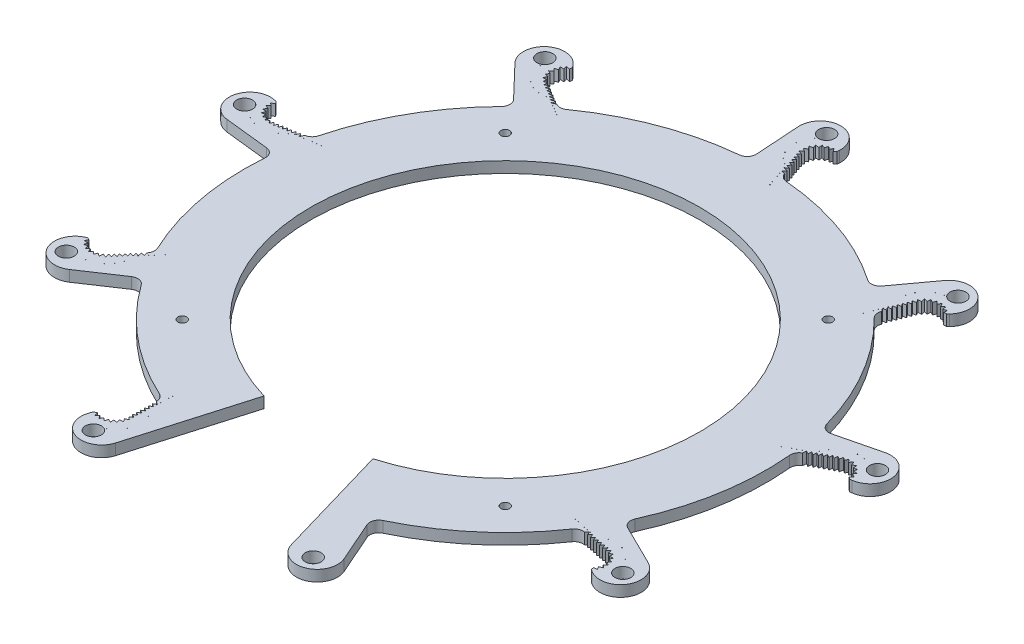
from build123d import *

# Parameters (mm, degrees)
SKETCH1_R             = 74.93
SKETCH1_R_2           = 55.88
BOSS_EXTRUDE1_DEPTH   = 3.175
BOSS_EXTRUDE2_START   = -3.175
BOSS_EXTRUDE2_DEPTH   = 3.175
CIRPATTERN1_COUNT     = 9
SKETCH4_R             = 1.27
CUT_EXTRUDE1_DEPTH    = 136.338367915
CIRPATTERN14_COUNT    = 4
CUT_EXTRUDE4_DEPTH    = 136.338367915
BOSS_EXTRUDE4_START   = -3.175
BOSS_EXTRUDE4_DEPTH   = 3.175
SKETCH11_R            = 0.0635
CUT_EXTRUDE6_DEPTH    = 136.338367915
CRVPATTERN8_OUTLINE_R = 0.0635
CRVPATTERN8_DEPTH     = 3.175
CIRPATTERN15_COUNT    = 9
SKETCH3_R             = 2.286
CUT_EXTRUDE8_DEPTH    = 136.338367915
CIRPATTERN16_COUNT    = 9


# Read off the part's stored shape, not the designer's step: CrvPattern8
with BuildPart() as part:
    # Sketch1 → Boss-Extrude1 (new body)
    with BuildSketch(Plane(origin=(0, 0, 0), x_dir=(1, 0, 0), z_dir=(0, 1, 0))):
        with Locations(Location((0, 0, 0), (0, 0, 270))):
            Circle(SKETCH1_R)
        with Locations(Location((0, 0, 0), (0, 0, 270))):
            Circle(SKETCH1_R_2, mode=Mode.SUBTRACT)
    extrude(amount=BOSS_EXTRUDE1_DEPTH)

    # Sketch2 → Boss-Extrude2 (add)
    with BuildSketch(Plane(origin=(0, 3.175, 0), x_dir=(1, 0, 0), z_dir=(0, 1, 0)).offset(BOSS_EXTRUDE2_START)):
        with BuildLine():
            Line((-5.064056346, 77.26256942), (-5.819443957, 88.787557242))
            Line((-5.819443957, 88.787557242), (-5.902505931, 90.054838075))
            ThreePointArc((-5.902505931, 90.054838075), (0, 96.356879518), (5.902505931, 90.054838075))
            Line((5.902505931, 90.054838075), (5.819443957, 88.787557242))
            ThreePointArc((5.819443957, 88.787557242), (2.098449739, 87.671421589), (1.290749174, 83.871529937))
            Line((1.290749174, 83.871529937), (3.81, 76.407857072))
            ThreePointArc((3.81, 76.407857072), (4.653675008, 75.217959105), (6.012781756, 74.68836158))
            ThreePointArc((6.012781756, 74.68836158), (-0.671023608, 74.926995318), (-7.349482994, 74.568693161))
            ThreePointArc((-7.349482994, 74.568693161), (-5.661743175, 75.453242541), (-5.064056346, 77.26256942))
        make_face()
    boss_extrude2 = extrude(amount=BOSS_EXTRUDE2_DEPTH)

    # CirPattern1: Boss-Extrude2 ×9 about axis
    cirpattern1_axis = Axis((0, 0, 0), (0, 1, 0))
    for i in range(1, CIRPATTERN1_COUNT):
        add(boss_extrude2.rotate(cirpattern1_axis, i * 360 / CIRPATTERN1_COUNT))

    # Sketch4 → Cut-Extrude1 (cut, through all)
    with BuildSketch(Plane(origin=(0, 3.175, 0), x_dir=(1, 0, 0), z_dir=(0, 1, 0))):
        with Locations(Location((46.383022865, 46.383022865, 0), (0, 0, 270))):
            Circle(SKETCH4_R)
    cut_extrude1 = extrude(amount=-CUT_EXTRUDE1_DEPTH, mode=Mode.SUBTRACT)

    # CirPattern14: Cut-Extrude1 ×4 about axis
    cirpattern14_axis = Axis((0, 0, 0), (0, 1, 0))
    for i in range(1, CIRPATTERN14_COUNT):
        add(cut_extrude1.rotate(cirpattern14_axis, i * 360 / CIRPATTERN14_COUNT), mode=Mode.SUBTRACT)

    # Sketch5 → Cut-Extrude4 (cut, through all)
    with BuildSketch(Plane(origin=(0, 3.175, 0), x_dir=(1, 0, 0), z_dir=(0, 1, 0))):
        with BuildLine():
            Line((-21.666698687, -74.335075624), (-15.636845304, -53.647585863))
            ThreePointArc((-15.636845304, -53.647585863), (0, -55.88), (15.636845304, -53.647585863))
            Line((15.636845304, -53.647585863), (21.042616141, -72.193945406))
            ThreePointArc((21.042616141, -72.193945406), (20.466014851, -72.151523412), (19.894757486, -72.240594713))
            ThreePointArc((19.894757486, -72.240594713), (0.671023608, -74.926995318), (-18.597740186, -72.585321932))
            ThreePointArc((-18.597740186, -72.585321932), (-20.486230546, -72.839285442), (-21.666698687, -74.335075624))
        make_face()
    extrude(amount=-CUT_EXTRUDE4_DEPTH, mode=Mode.SUBTRACT)

    # Sketch8 → Boss-Extrude4 (add)
    with BuildSketch(Plane(origin=(0, 3.175, 0), x_dir=(1, 0, 0), z_dir=(0, 1, 0)).offset(BOSS_EXTRUDE4_START)):
        with BuildLine():
            Line((22.552797342, -73.102996207), (27.472845216, -79.254919994))
            ThreePointArc((27.472845216, -79.254919994), (28.013494443, -83.101900001), (24.89864451, -85.423379414))
            Line((24.89864451, -85.423379414), (21.042616141, -72.193945406))
            ThreePointArc((21.042616141, -72.193945406), (21.879091216, -72.513269007), (22.552797342, -73.102996207))
        make_face()
    extrude(amount=BOSS_EXTRUDE4_DEPTH)

    # Sketch11 → Cut-Extrude6 (cut, through all)
    with BuildSketch(Plane(origin=(0, 3.175, 0), x_dir=(1, 0, 0), z_dir=(0, 1, 0))):
        with Locations(Location((4.474572189, 71.558672285, 0), (0, 0, 270))):
            Circle(SKETCH11_R)
        Polygon((3.549558349, 77.576568772), (3.955715036, 76.373266339), (2.789994746, 76.649992206), align=None)
    cut_extrude6 = extrude(amount=-CUT_EXTRUDE6_DEPTH, mode=Mode.SUBTRACT)

    # CrvPattern8 outline → CrvPattern8 (cut)
    with BuildSketch(Plane(origin=(0, 0, 0), x_dir=(1, 0, 0), z_dir=(0, 1, 0))):
        with BuildLine():
            Line((3.097579554, 78.503714914), (2.436499606, 77.697276603))
            Line((2.436499606, 77.697276603), (3.451074694, 77.456430516))
            Line((3.451074694, 77.456430516), (3.454612898, 77.460746701))
            Line((3.454612898, 77.460746701), (1.290749174, 83.871529937))
            ThreePointArc((1.290749174, 83.871529937), (2.098449739, 87.671421589), (5.819443957, 88.787557242))
            Line((5.819443957, 88.787557242), (5.865311332, 89.48735815))
            Line((5.865311332, 89.48735815), (5.279171067, 88.920535759))
            Line((5.279171067, 88.920535759), (4.681942257, 89.783907231))
            Line((4.681942257, 89.783907231), (4.16758502, 88.868741026))
            Line((4.16758502, 88.868741026), (3.348336382, 89.52518921))
            Line((3.348336382, 89.52518921), (3.117267192, 88.501128871))
            Line((3.117267192, 88.501128871), (2.144469413, 88.895789522))
            Line((2.144469413, 88.895789522), (2.216000438, 87.848423368))
            Line((2.216000438, 87.848423368), (1.170957445, 87.948311768))
            Line((1.170957445, 87.948311768), (1.539110307, 86.965175958))
            Line((1.539110307, 86.965175958), (0.509164097, 86.761943693))
            Line((0.509164097, 86.761943693), (1.143169529, 85.925206182))
            Line((1.143169529, 85.925206182), (0.214400348, 85.435838878))
            Line((0.214400348, 85.435838878), (1.061269813, 84.815432028))
            Line((1.061269813, 84.815432028), (0.311301792, 84.080829743))
            Line((0.311301792, 84.080829743), (1.316042103, 83.722983252))
            Line((1.316042103, 83.722983252), (0.669023906, 82.933698593))
            Line((0.669023906, 82.933698593), (1.683598995, 82.692852506))
            Line((1.683598995, 82.692852506), (1.022519046, 81.886414195))
            Line((1.022519046, 81.886414195), (2.037094135, 81.645568108))
            Line((2.037094135, 81.645568108), (1.376014186, 80.839129797))
            Line((1.376014186, 80.839129797), (2.390589275, 80.59828371))
            Line((2.390589275, 80.59828371), (1.729509326, 79.791845399))
            Line((1.729509326, 79.791845399), (2.744084415, 79.550999312))
            Line((2.744084415, 79.550999312), (2.083004466, 78.744561001))
            Line((2.083004466, 78.744561001), (3.097579554, 78.503714914))
        make_face()
        with Locations((4.121077049, 72.605956683)):
            Circle(CRVPATTERN8_OUTLINE_R)
        with Locations((3.767581909, 73.65324108)):
            Circle(CRVPATTERN8_OUTLINE_R)
        with Locations((3.414086769, 74.700525478)):
            Circle(CRVPATTERN8_OUTLINE_R)
        with Locations((3.060591629, 75.747809876)):
            Circle(CRVPATTERN8_OUTLINE_R)
        with Locations((2.707096489, 76.795094274)):
            Circle(CRVPATTERN8_OUTLINE_R)
        with Locations((2.353601349, 77.842378672)):
            Circle(CRVPATTERN8_OUTLINE_R)
        with Locations((1.43161538, 78.836381521)):
            Circle(CRVPATTERN8_OUTLINE_R)
        with Locations((-0.212336709, 80.090070909)):
            Circle(CRVPATTERN8_OUTLINE_R)
        with Locations((-1.428958023, 81.761641467)):
            Circle(CRVPATTERN8_OUTLINE_R)
        with Locations((-2.116566493, 83.711387642)):
            Circle(CRVPATTERN8_OUTLINE_R)
        with Locations((-2.217693578, 85.776354679)):
            Circle(CRVPATTERN8_OUTLINE_R)
        with Locations((-1.723887336, 87.783957964)):
            Circle(CRVPATTERN8_OUTLINE_R)
        with Locations((-0.67641882, 89.566407194)):
            Circle(CRVPATTERN8_OUTLINE_R)
        with Locations((0.837167256, 90.974729864)):
            Circle(CRVPATTERN8_OUTLINE_R)
    crvpattern8 = extrude(amount=CRVPATTERN8_DEPTH, mode=Mode.SUBTRACT)

    # CirPattern15: Cut-Extrude6, CrvPattern8 ×9 about axis, 1 skipped
    cirpattern15_axis = Axis((0, 0, 0), (0, -1, 0))
    add([cut_extrude6.rotate(cirpattern15_axis, i * 360 / CIRPATTERN15_COUNT) for i in range(1, CIRPATTERN15_COUNT) if i not in (4,)], mode=Mode.SUBTRACT)
    add([crvpattern8.rotate(cirpattern15_axis, i * 360 / CIRPATTERN15_COUNT) for i in range(1, CIRPATTERN15_COUNT) if i not in (4,)], mode=Mode.SUBTRACT)

    # Sketch3 → Cut-Extrude8 (cut, through all)
    with BuildSketch(Plane(origin=(0, 3.175, 0), x_dir=(1, 0, 0), z_dir=(0, 1, 0))):
        with Locations(Location((0, 92.292879518, 0), (0, 0, 270))):
            Circle(SKETCH3_R)
    cut_extrude8 = extrude(amount=-CUT_EXTRUDE8_DEPTH, mode=Mode.SUBTRACT)

    # CirPattern16: Cut-Extrude8 ×9 about axis
    cirpattern16_axis = Axis((0, 0, 0), (0, 1, 0))
    for i in range(1, CIRPATTERN16_COUNT):
        add(cut_extrude8.rotate(cirpattern16_axis, i * 360 / CIRPATTERN16_COUNT), mode=Mode.SUBTRACT)


solid = part.part
